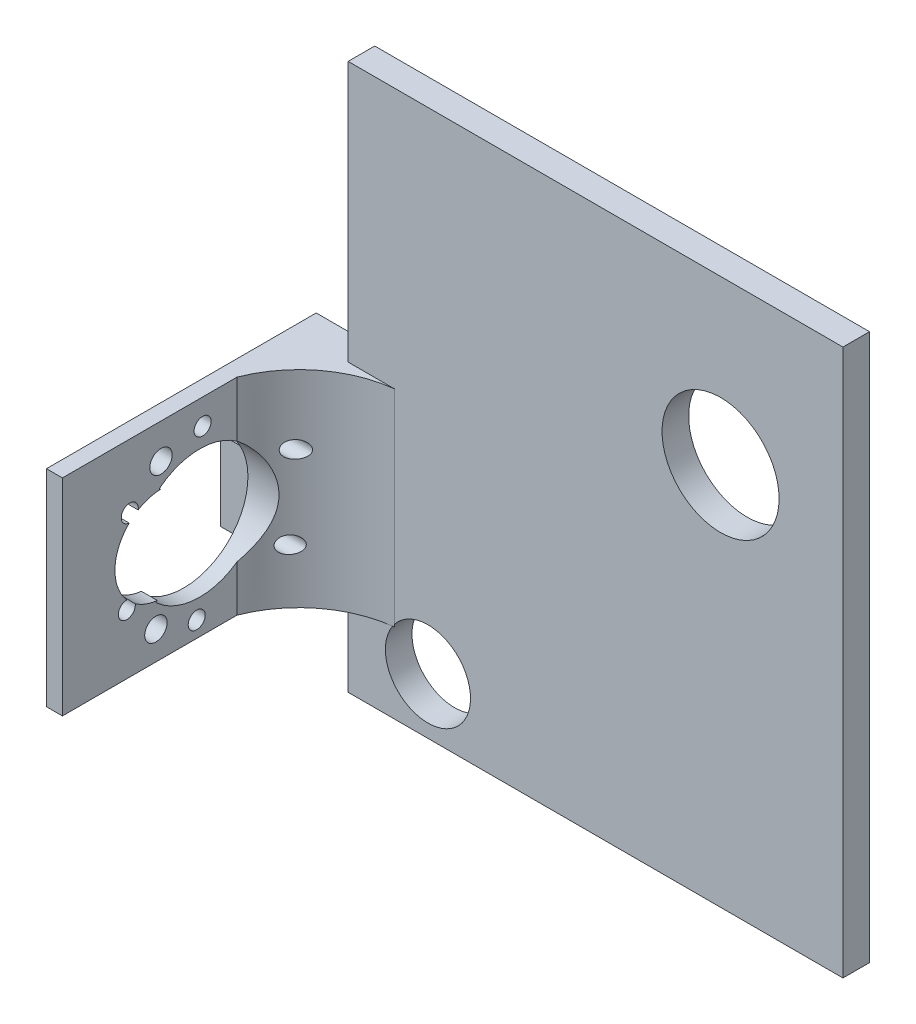
from build123d import *

# Parameters (mm, degrees)
SKETCH1_R                 = 8
SKETCH1_R_2               = 11
BOSS_EXTRUDE1_DEPTH       = 5
BOSS_EXTRUDE2_DEPTH       = 11
BOSS_EXTRUDE3_OUTLINE_R   = 1.6
BOSS_EXTRUDE3_OUTLINE_R_2 = 2.1
BOSS_EXTRUDE3_DEPTH       = 3
SKETCH3_W                 = 15
SKETCH3_H                 = 38.75
CUT_EXTRUDE1_DEPTH        = 3
BOSS_EXTRUDE4_REACH       = 120.779
CUT_EXTRUDE3_START        = 3
CUT_EXTRUDE3_OUTLINE_R    = 1.6
CUT_EXTRUDE3_DEPTH        = 5.935416332


# Read off the part's stored shape, not the designer's step: Boss-Extrude3, Cut-Extrude3
with BuildPart() as part:
    # Sketch1 → Boss-Extrude1 (new body)
    with BuildSketch(Plane.XY):
        Polygon((-24, 15), (0, 15), (0, 0), (93, 0), (93, 102.7), (0, 102.7), (0, 30), (-24, 30), align=None)
        with Locations((15, 10.5)):
            Circle(SKETCH1_R, mode=Mode.SUBTRACT)
        with Locations((70, 72)):
            Circle(SKETCH1_R_2, mode=Mode.SUBTRACT)
    extrude(amount=BOSS_EXTRUDE1_DEPTH)

    # Sketch2 → Boss-Extrude2 (add)
    with BuildSketch(Plane(origin=(-11, 0, 0), x_dir=(0, 0, -1), z_dir=(1, 0, 0))):
        Polygon((-6.40446571, 53.75), (-6.40446571, 33.5), (-6.40446571, 30), (0, 30), (0, 53.75), align=None)
    extrude(amount=BOSS_EXTRUDE2_DEPTH)

    # Boss-Extrude3 outline → Boss-Extrude3 (add)
    with BuildSketch(Plane(origin=(-11, 0, 0), x_dir=(0, 0, -1), z_dir=(1, 0, 0))):
        Polygon((-65.7, 15), (-5, 15), (-5, 30), (-6.40446571, 30), (-6.40446571, 53.75), (-65.7, 53.75), align=None)
        with Locations((-25.458037139, 18.009888358)):
            Circle(BOSS_EXTRUDE3_OUTLINE_R, mode=Mode.SUBTRACT)
        with Locations((-33.128928451, 20.361955525)):
            Circle(BOSS_EXTRUDE3_OUTLINE_R_2, mode=Mode.SUBTRACT)
        with BuildLine():
            ThreePointArc((-36.471534651, 41.421088598), (-34.422063775, 42.316430041), (-32.214396715, 42.674443066))
            add(Edge.make_bspline(
                [(-32.214396715, 42.674443066), (-32.258484047, 42.672889926), (-32.30288803, 42.678244048), (-32.383949881, 42.711721435), (-32.420720422, 42.742067925), (-32.450943892, 42.825768035), (-32.442187299, 42.872669516), (-32.401895098, 42.950423281), (-32.37149194, 42.983188581), (-32.336739051, 43.010347732)],
                knots=[0, 0, 0, 0, 0.25, 0.25, 0.5, 0.5, 0.75, 0.75, 1, 1, 1, 1], degree=3))
            ThreePointArc((-32.336739051, 43.010347732), (-12.84214513, 33.068927831), (-32.99665635, 24.544451349))
            add(Edge.make_bspline(
                [(-32.99665635, 24.544451349), (-33.029388791, 24.574028225), (-33.057393425, 24.608892702), (-33.092046693, 24.689435058), (-33.097377316, 24.736767464), (-33.061272852, 24.818024197), (-33.022299349, 24.845743133), (-32.93918463, 24.87327764), (-32.894502735, 24.8754612), (-32.850648228, 24.870765952)],
                knots=[0, 0, 0, 0, 0.25, 0.25, 0.5, 0.5, 0.75, 0.75, 1, 1, 1, 1], degree=3))
            ThreePointArc((-32.850648228, 24.870765952), (-35.02712744, 25.385455582), (-37.007457913, 26.424810377))
            ThreePointArc((-37.007457913, 26.424810377), (-39.660439788, 25.039720747), (-38.589504277, 27.83433758))
            ThreePointArc((-38.589504277, 27.83433758), (-40.824282289, 34.06892783), (-38.150161467, 40.128088348))
            ThreePointArc((-38.150161467, 40.128088348), (-39.018876857, 42.992022649), (-36.471534651, 41.421088598))
        make_face(mode=Mode.SUBTRACT)
        with Locations((-11.766421235, 25.275537259)):
            Circle(BOSS_EXTRUDE3_OUTLINE_R, mode=Mode.SUBTRACT)
        with Locations((-9.414354068, 32.946428571)):
            Circle(BOSS_EXTRUDE3_OUTLINE_R_2, mode=Mode.SUBTRACT)
        with Locations((-11.212849807, 40.765648901)):
            Circle(BOSS_EXTRUDE3_OUTLINE_R, mode=Mode.SUBTRACT)
        with Locations((-32.170114611, 47.191615903)):
            Circle(BOSS_EXTRUDE3_OUTLINE_R_2, mode=Mode.SUBTRACT)
        with Locations((-24.350894282, 48.990111642)):
            Circle(BOSS_EXTRUDE3_OUTLINE_R, mode=Mode.SUBTRACT)
    extrude(amount=BOSS_EXTRUDE3_DEPTH)

    # Sketch3 → Cut-Extrude1 (cut)
    with BuildSketch(Plane(origin=(-8, 0, 0), x_dir=(0, 0, -1), z_dir=(1, 0, 0))):
        with Locations((-58.2, 34.375)):
            Rectangle(SKETCH3_W, SKETCH3_H)
    extrude(amount=-CUT_EXTRUDE1_DEPTH, mode=Mode.SUBTRACT)

    # Boss-Extrude4: up to this face of the body (flat: up to its plane)
    boss_extrude4_end = Plane(part.part.faces().sort_by_distance((-10.666861144, 15, 16.018028005))[0])
    # Sketch4 → Boss-Extrude4 (add, up to the picked face)
    with BuildSketch(Plane(origin=(0, 53.75, 0), x_dir=(1, 0, 0), z_dir=(0, 1, 0)), mode=Mode.PRIVATE) as boss_extrude4_sk1:
        with BuildLine():
            Line((8.727174225, -5), (-8, -5))
            Line((-8, -5), (-8, -17.898489496))
            ThreePointArc((-8, -17.898489496), (-1.439507221, -9.110934277), (8.727174225, -5))
        make_face()
    boss_extrude4_tool1 = split(extrude(boss_extrude4_sk1.sketch, amount=-BOSS_EXTRUDE4_REACH, mode=Mode.PRIVATE), bisect_by=boss_extrude4_end, keep=Keep.BOTH, mode=Mode.PRIVATE)
    add(boss_extrude4_tool1.solids().sort_by(Axis((-3.750344, 53.75, 8.522384), (0, -1, 0)))[0])

    # Cut-Extrude3 outline → Cut-Extrude3 (cut)
    with BuildSketch(Plane(origin=(-11, 0, 0), x_dir=(0, 0, -1), z_dir=(1, 0, 0)).offset(CUT_EXTRUDE3_START)):
        with BuildLine():
            ThreePointArc((-19, 22.972764576), (-12.834444956, 33.5), (-19, 44.027235424))
            Line((-19, 44.027235424), (-19, 22.972764576))
        make_face()
        with Locations((-11.766421235, 25.275537259)):
            Circle(CUT_EXTRUDE3_OUTLINE_R)
        with Locations((-11.212849807, 40.765648901)):
            Circle(CUT_EXTRUDE3_OUTLINE_R)
    extrude(amount=CUT_EXTRUDE3_DEPTH, mode=Mode.SUBTRACT)


solid = part.part
